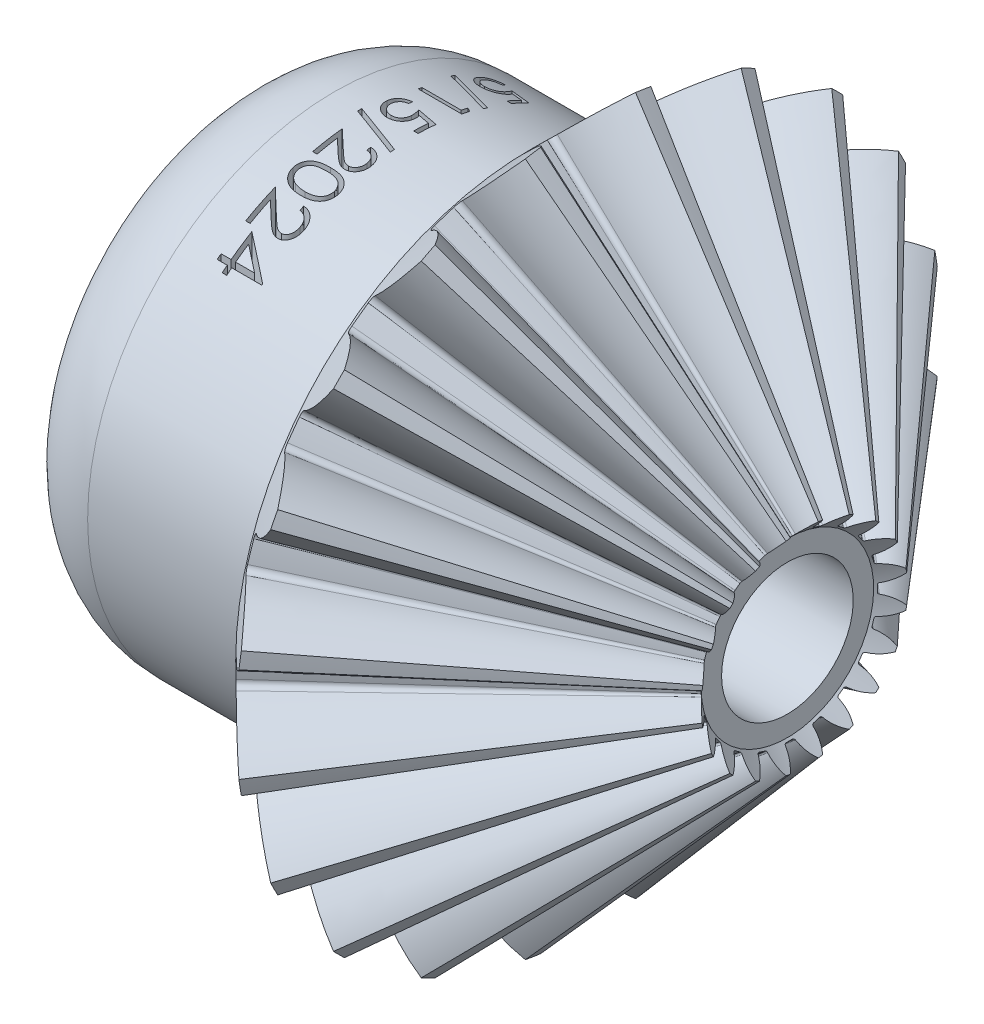
from build123d import *

# Parameters (mm, degrees)
TEETHCUTS_COUNT     = 20
TEETHCUTS_ANGLE     = 342
HUBSKE_R            = 7.5
HUB_DEPTH           = 8.949164146
BORSKE_R            = 2
BORE_DEPTH          = 20.0000508
FILLET2_R           = 3
SKETCH2_R           = 1.4
CUT_EXTRUDE1_DEPTH  = 10
SKETCH4_R           = 1.4
CUT_EXTRUDE2_DEPTH  = 10
BOSS_EXTRUDE1_START = -10
BOSS_EXTRUDE1_DEPTH = 10
CHAMFER1_SIZE       = 1
CUT_EXTRUDE3_START  = 5
CUT_EXTRUDE3_DEPTH  = 5


with BuildPart() as part:
    # BasProSke → Base-Revolve (revolve)
    with BuildSketch(Plane(origin=(0, 0, 0), x_dir=(1, 0, 0), z_dir=(0, 1, 0)), mode=Mode.PRIVATE) as base_revolve_sk:
        Polygon((0, 0), (0, 8.949062546), (1.758044235, 10.707106781), (8.329112047, 3.136038969), (7.814192812, 2.621119735), (7.814192812, 0), align=None)
    revolve(base_revolve_sk.sketch.rotate(Axis((-10, 0, 0), (1, 0, 0)), 180), axis=Axis((-10, 0, 0), (1, 0, 0)))

    # ToothCut: read off the stored shape, not the designer's step
    # ToothCut: loft between two sections, ruled curve by curve
    toothcut_from = [
        Edge.make_bspline([(11.056978067, 0.006040613, -0.009397446), (11.052757652, 0.001820198, -0.014823153), (11.047082229, -0.003855225, -0.014022361), (11.043703021, -0.007234432, -0.007524359)], [0, 0, 0, 0, 1, 1, 1, 1], 3, [1, 0.779680287, 0.779680287, 1]),
        Edge.make_bspline([(11.043703021, -0.007234432, 0.007524359), (11.047082229, -0.003855225, 0.014022361), (11.052757652, 0.001820198, 0.014823153), (11.056978067, 0.006040613, 0.009397446)], [0, 0, 0, 0, 1, 1, 1, 1], 3, [1, 0.779680287, 0.779680287, 1]),
        Edge.make_bspline([(11.043703021, -0.007234432, -0.007524359), (11.043200964, -0.00773649, -0.006558934), (11.04279988, -0.008137574, -0.005503268), (11.042507739, -0.008429715, -0.004378334)], [0, 0, 0, 0, 1, 1, 1, 1], 3, [1, 0.993377071, 0.993377071, 1]),
        Edge.make_bspline([(11.042507739, -0.008429715, 0.004378334), (11.04279988, -0.008137574, 0.005503268), (11.043200964, -0.00773649, 0.006558934), (11.043703021, -0.007234432, 0.007524359)], [0, 0, 0, 0, 1, 1, 1, 1], 3, [1, 0.993377071, 0.993377071, 1]),
        Edge.make_bspline([(11.042507739, -0.008429715, -0.004378334), (11.041765864, -0.00917159, -0.001521635), (11.041765864, -0.00917159, 0.001521635), (11.042507739, -0.008429715, 0.004378334)], [0, 0, 0, 0, 1, 1, 1, 1], 3, [1, 0.959129516, 0.959129516, 1]),
        Edge.make_line((11.056978067, 0.006040613, 0.009397446), (11.056978067, 0.006040613, -0.009397446)),
    ]
    toothcut_to = [
        Edge.make_bspline([(1.831702173, 10.78076472, -1.608058394), (1.416177175, 10.365239721, -1.022568098), (0.89518614, 9.844248687, -0.641441323), (0.317192873, 9.26625542, -0.500131372)], [0, 0, 0, 0, 1, 1, 1, 1], 3, [1, 0.968992554, 0.968992554, 1]),
        Edge.make_bspline([(0.317192873, 9.26625542, 0.500131372), (0.89518614, 9.844248687, 0.641441323), (1.416177175, 10.365239721, 1.022568098), (1.831702173, 10.78076472, 1.608058394)], [0, 0, 0, 0, 1, 1, 1, 1], 3, [1, 0.968992554, 0.968992554, 1]),
        Edge.make_bspline([(0.317192873, 9.26625542, -0.500131372), (0.248143517, 9.197206063, -0.483249928), (0.203953059, 9.153015606, -0.406340777), (0.206397022, 9.155459568, -0.307302074)], [0, 0, 0, 0, 1, 1, 1, 1], 3, [1, 0.835744927, 0.835744927, 1]),
        Edge.make_bspline([(0.206397022, 9.155459568, 0.307302074), (0.203953059, 9.153015606, 0.406340777), (0.248143517, 9.197206063, 0.483249928), (0.317192873, 9.26625542, 0.500131372)], [0, 0, 0, 0, 1, 1, 1, 1], 3, [1, 0.835744927, 0.835744927, 1]),
        Edge.make_bspline([(0.206397022, 9.155459568, -0.307302074), (0.211451493, 9.160514039, -0.102475588), (0.211451493, 9.160514039, 0.102475588), (0.206397022, 9.155459568, 0.307302074)], [0, 0, 0, 0, 1, 1, 1, 1], 3, [1, 0.999594406, 0.999594406, 1]),
        Edge.make_line((1.831702173, 10.78076472, 1.608058394), (1.831702173, 10.78076472, -1.608058394)),
    ]
    toothcut = Solid(Shell([*[Face.make_surface_from_curves(toothcut_from[k], toothcut_to[k]) for k in range(6)], Face(Wire(toothcut_from)), Face(Wire(toothcut_to))]))
    add(toothcut, mode=Mode.SUBTRACT)

    # TeethCuts: ToothCut ×20 about axis
    teethcuts_axis = Axis((-10, 0, 0), (1, 0, 0))
    for i in range(1, TEETHCUTS_COUNT):
        add(toothcut.rotate(teethcuts_axis, i * TEETHCUTS_ANGLE / (TEETHCUTS_COUNT - 1)), mode=Mode.SUBTRACT)

    # HubSke → Hub (add)
    with BuildSketch(Plane.ZY):
        with Locations(Location((0, 0, 0), (0, 0, 180))):
            Circle(HUBSKE_R)
    extrude(amount=HUB_DEPTH)

    # BorSke → Bore (cut, symmetric)
    with BuildSketch(Plane(origin=(0, 0, 0), x_dir=(0, 0, -1), z_dir=(1, 0, 0))):
        with Locations(Location((0, 0, 0), (0, 0, 180))):
            Circle(BORSKE_R)
    extrude(amount=BORE_DEPTH, both=True, mode=Mode.SUBTRACT)

    # Fillet2
    fillet2_edges = [part.edges().sort_by_distance(p)[0] for p in [
        (-8.949164146, 0, 7.5),
    ]]
    fillet(fillet2_edges, radius=FILLET2_R)

    # Sketch2 → Cut-Extrude1 (cut)
    with BuildSketch(Plane.XY):
        with Locations((-3.949164146, 0)):
            Circle(SKETCH2_R)
    extrude(amount=-CUT_EXTRUDE1_DEPTH, mode=Mode.SUBTRACT)

    # Sketch4 → Cut-Extrude2 (cut)
    with BuildSketch(Plane(origin=(0, 0, 0), x_dir=(1, 0, 0), z_dir=(0, 1, 0))):
        with Locations(Location((-3.949164146, 0, 0), (0, 0, 270))):
            Circle(SKETCH4_R)
    extrude(amount=-CUT_EXTRUDE2_DEPTH, mode=Mode.SUBTRACT)

    # Boss-Extrude1: read off the stored shape, not the designer's step
    # Boss-Extrude1 outline → Boss-Extrude1 (add)
    with BuildSketch(Plane.ZY.offset(8.949164146).offset(BOSS_EXTRUDE1_START)):
        with BuildLine():
            Line((-1.5, -1.322875656), (-1.499999766, 1.322875921))
            ThreePointArc((-1.499999766, 1.322875921), (-2, 1.77e-07), (-1.5, -1.322875656))
        make_face()
    extrude(amount=BOSS_EXTRUDE1_DEPTH)

    # Chamfer1
    chamfer1_edges = [part.edges().sort_by_distance(p)[0] for p in [
        (0, 0, 7.5),
    ]]
    chamfer(chamfer1_edges, length=CHAMFER1_SIZE)

    # Sketch7 → Cut-Extrude3 (cut)
    # profile 1 of 9: a face of its own
    with BuildSketch(Plane(origin=(0, 0, 0), x_dir=(1, 0, 0), z_dir=(0, 1, 0)).offset(CUT_EXTRUDE3_START)):
        with BuildLine():
            Line((-3.577080754, 3.003521014), (-3.712764515, 3.003521014))
            Line((-3.712764515, 3.003521014), (-3.712764515, 3.453503486))
            Line((-3.712764515, 3.453503486), (-4.060719159, 3.524790462))
            add(Edge.make_bspline(
                [(-4.060719159, 3.524790462), (-4.05685236, 3.510784224), (-4.049361048, 3.483649353), (-4.041043391, 3.443599048), (-4.036029369, 3.40557759), (-4.035344736, 3.380905054), (-4.035013446, 3.368966143)],
                knots=[0, 0, 0, 0, 1.100273476, 2.13160584, 3.095893838, 4, 4, 4, 4], degree=3))
            add(Edge.make_bspline(
                [(-4.035013446, 3.368966143), (-4.035333274, 3.354193471), (-4.035962134, 3.325146707), (-4.041997923, 3.282646738), (-4.051504531, 3.24208009), (-4.064763577, 3.203516075), (-4.081827793, 3.166871628), (-4.102867614, 3.13235139), (-4.127737509, 3.099759721), (-4.156197527, 3.069527472), (-4.187558575, 3.042143315), (-4.221167823, 3.017971234), (-4.25705584, 2.997867864), (-4.295063932, 2.98132852), (-4.335128327, 2.968206147), (-4.37754558, 2.959448217), (-4.421939277, 2.953623012), (-4.452292339, 2.952971721), (-4.467770441, 2.952639604)],
                knots=[0, 0, 0, 0, 1.052772836, 2.070014431, 3.053871312, 4.019926262, 4.972333346, 5.930471369, 6.896690565, 7.89035727, 8.885779078, 9.861050232, 10.836829716, 11.812751485, 12.812646763, 13.836748493, 14.896881366, 16, 16, 16, 16], degree=3))
            add(Edge.make_bspline(
                [(-4.467770441, 2.952639604), (-4.478551175, 2.952890953), (-4.499966952, 2.953390254), (-4.531771249, 2.955930216), (-4.56290321, 2.960817762), (-4.593362369, 2.967389163), (-4.623108004, 2.975884554), (-4.652129296, 2.986280526), (-4.680515607, 2.998534814), (-4.708268795, 3.012370195), (-4.734533274, 3.028375167), (-4.759714475, 3.045234538), (-4.782885678, 3.063910079), (-4.804892786, 3.083497616), (-4.824871545, 3.104780371), (-4.843676932, 3.127097763), (-4.860492081, 3.150973526), (-4.875958221, 3.175980194), (-4.889806003, 3.202101998), (-4.901357526, 3.229603808), (-4.911482536, 3.257881888), (-4.919716248, 3.287188277), (-4.926104418, 3.317466199), (-4.930454675, 3.34881992), (-4.933619866, 3.381092111), (-4.933818184, 3.402967442), (-4.933918361, 3.414017392)],
                knots=[0, 0, 0, 0, 1.05623316, 2.098192244, 3.122504159, 4.140841222, 5.148757784, 6.150489607, 7.158294732, 8.176043417, 9.185147859, 10.169157858, 11.142149047, 12.097904048, 13.0527185, 13.998867679, 14.954465986, 15.910220987, 16.877849176, 17.847023716, 18.829548819, 19.818454515, 20.826519638, 21.858115382, 22.918063636, 24, 24, 24, 24], degree=3))
            add(Edge.make_bspline(
                [(-4.933918361, 3.414017392), (-4.933657218, 3.427198986), (-4.933143449, 3.453132214), (-4.927769527, 3.491126825), (-4.92007126, 3.527681804), (-4.908495818, 3.562507849), (-4.893970324, 3.595898789), (-4.875728842, 3.627410126), (-4.854768549, 3.657661231), (-4.830366244, 3.685829914), (-4.80344415, 3.711920804), (-4.774541653, 3.735635155), (-4.743543831, 3.7564325), (-4.71071458, 3.77439771), (-4.675997413, 3.78969964), (-4.639288442, 3.801726425), (-4.600772334, 3.811431827), (-4.574256024, 3.815537997), (-4.560788019, 3.817623578)],
                knots=[0, 0, 0, 0, 1.046825758, 2.059506013, 3.044032586, 4.011925612, 4.970610144, 5.93275819, 6.900651216, 7.891265644, 8.889116719, 9.876966323, 10.858259055, 11.851035124, 12.847502422, 13.86866322, 14.9174643, 16, 16, 16, 16], degree=3))
            Line((-4.560788019, 3.817623578), (-4.560788019, 3.698900288))
            add(Edge.make_bspline(
                [(-4.560788019, 3.698900288), (-4.573404727, 3.695980916), (-4.59765474, 3.69036972), (-4.631706224, 3.678021058), (-4.66216494, 3.663015619), (-4.689059643, 3.644766608), (-4.712635716, 3.623437942), (-4.733826756, 3.599274397), (-4.75269126, 3.57193173), (-4.768516963, 3.541559663), (-4.781994049, 3.509498316), (-4.790972916, 3.475947495), (-4.797285118, 3.441814323), (-4.797917049, 3.41872819), (-4.7982346, 3.407127201)],
                knots=[0, 0, 0, 0, 1.136389429, 2.184203582, 3.172920998, 4.111012962, 5.028380909, 5.957351669, 6.927793475, 7.937618031, 8.960409703, 9.974842029, 10.982339866, 12, 12, 12, 12], degree=3))
            add(Edge.make_bspline(
                [(-4.7982346, 3.407127201), (-4.797924366, 3.395803622), (-4.797313512, 3.373507403), (-4.792611861, 3.340694766), (-4.785370755, 3.309015495), (-4.774534233, 3.278782179), (-4.761363759, 3.249465763), (-4.744462525, 3.22180782), (-4.725011863, 3.195008221), (-4.702727661, 3.169899968), (-4.678170663, 3.146904105), (-4.651909862, 3.126585571), (-4.623895459, 3.109660964), (-4.594612452, 3.095398369), (-4.563739902, 3.084568104), (-4.531422494, 3.0768419), (-4.497580403, 3.07230503), (-4.474497658, 3.071680923), (-4.462735301, 3.071362895)],
                knots=[0, 0, 0, 0, 1.027316725, 2.022795036, 3.002884548, 3.971462791, 4.93288096, 5.914575861, 6.907176829, 7.935150275, 8.956128384, 9.956726525, 10.942570165, 11.921478529, 12.907843606, 13.90538589, 14.932640048, 16, 16, 16, 16], degree=3))
            add(Edge.make_bspline(
                [(-4.462735301, 3.071362895), (-4.452116942, 3.071571696), (-4.431321102, 3.07198063), (-4.401030405, 3.076524886), (-4.372161606, 3.082890683), (-4.344972871, 3.092664552), (-4.319066059, 3.104740998), (-4.294995671, 3.120062295), (-4.272143297, 3.137576115), (-4.251437304, 3.158089643), (-4.232197651, 3.180458774), (-4.215820416, 3.20520277), (-4.202036359, 3.23175724), (-4.190142637, 3.259814843), (-4.181599973, 3.290039509), (-4.17518655, 3.321833639), (-4.171476567, 3.355540298), (-4.170961807, 3.378585769), (-4.170697207, 3.390431738)],
                knots=[0, 0, 0, 0, 1.045726679, 2.048034203, 3.01323695, 3.95502507, 4.889743367, 5.8246644, 6.761650845, 7.722168973, 8.692072792, 9.66525385, 10.638902184, 11.638179751, 12.663148338, 13.728659964, 14.832472288, 16, 16, 16, 16], degree=3))
            add(Edge.make_bspline(
                [(-4.170697207, 3.390431738), (-4.170909205, 3.400774876), (-4.171343197, 3.421948886), (-4.174758625, 3.454503889), (-4.180012933, 3.48856544), (-4.187586067, 3.524265777), (-4.197068152, 3.561506926), (-4.208910087, 3.60035082), (-4.222550504, 3.640798398), (-4.233130475, 3.668022513), (-4.238539087, 3.681939818)],
                knots=[0, 0, 0, 0, 0.824638674, 1.688163388, 2.607705698, 3.571998603, 4.597075385, 5.671199175, 6.809488238, 8, 8, 8, 8], degree=3))
            Line((-4.238539087, 3.681939818), (-3.577080754, 3.546256057))
            Line((-3.577080754, 3.546256057), (-3.577080754, 3.003521014))
        make_face()
    # profile 2 of 9: a face of its own
    with BuildSketch(Plane(origin=(0, 0, 0), x_dir=(1, 0, 0), z_dir=(0, 1, 0)).offset(CUT_EXTRUDE3_START)):
        Polygon((-3.543159814, 2.12157657), (-5.086562592, 2.674911906), (-5.086562592, 2.799995373), (-3.543159814, 2.246660037), align=None)
    # profile 3 of 9: a face of its own
    with BuildSketch(Plane(origin=(0, 0, 0), x_dir=(1, 0, 0), z_dir=(0, 1, 0)).offset(CUT_EXTRUDE3_START)):
        Polygon((-3.577080754, 1.738640956), (-3.577080754, 1.494039177), (-4.899997421, 1.494039177), (-4.899997421, 1.612762467), (-3.712764515, 1.612762467), (-3.712764515, 1.816288108), align=None)
    # profile 4 of 9: a face of its own
    with BuildSketch(Plane(origin=(0, 0, 0), x_dir=(1, 0, 0), z_dir=(0, 1, 0)).offset(CUT_EXTRUDE3_START)):
        with BuildLine():
            Line((-3.577080754, 0.17112251), (-3.712764515, 0.17112251))
            Line((-3.712764515, 0.17112251), (-3.712764515, 0.621104982))
            Line((-3.712764515, 0.621104982), (-4.060719159, 0.692391958))
            add(Edge.make_bspline(
                [(-4.060719159, 0.692391958), (-4.05685236, 0.67838572), (-4.049361048, 0.651250848), (-4.041043391, 0.611200544), (-4.036029369, 0.573179086), (-4.035344736, 0.54850655), (-4.035013446, 0.536567639)],
                knots=[0, 0, 0, 0, 1.100273476, 2.13160584, 3.095893838, 4, 4, 4, 4], degree=3))
            add(Edge.make_bspline(
                [(-4.035013446, 0.536567639), (-4.035333274, 0.521794967), (-4.035962134, 0.492748203), (-4.041997923, 0.450248233), (-4.051504531, 0.409681586), (-4.064763577, 0.37111757), (-4.081827793, 0.334473124), (-4.102867614, 0.299952886), (-4.127737509, 0.267361217), (-4.156197527, 0.237128967), (-4.187558575, 0.209744811), (-4.221167823, 0.18557273), (-4.25705584, 0.16546936), (-4.295063932, 0.148930016), (-4.335128327, 0.135807643), (-4.37754558, 0.127049713), (-4.421939277, 0.121224507), (-4.452292339, 0.120573216), (-4.467770441, 0.1202411)],
                knots=[0, 0, 0, 0, 1.052772836, 2.070014431, 3.053871312, 4.019926262, 4.972333346, 5.930471369, 6.896690565, 7.89035727, 8.885779078, 9.861050232, 10.836829716, 11.812751485, 12.812646763, 13.836748493, 14.896881366, 16, 16, 16, 16], degree=3))
            add(Edge.make_bspline(
                [(-4.467770441, 0.1202411), (-4.478551175, 0.120492449), (-4.499966952, 0.120991749), (-4.531771249, 0.123531712), (-4.56290321, 0.128419258), (-4.593362369, 0.134990659), (-4.623108004, 0.14348605), (-4.652129296, 0.153882022), (-4.680515607, 0.16613631), (-4.708268795, 0.179971691), (-4.734533274, 0.195976663), (-4.759714475, 0.212836033), (-4.782885678, 0.231511575), (-4.804892786, 0.251099111), (-4.824871545, 0.272381867), (-4.843676932, 0.294699259), (-4.860492081, 0.318575022), (-4.875958221, 0.343581689), (-4.889806003, 0.369703494), (-4.901357526, 0.397205304), (-4.911482536, 0.425483384), (-4.919716248, 0.454789773), (-4.926104418, 0.485067695), (-4.930454675, 0.516421416), (-4.933619866, 0.548693607), (-4.933818184, 0.570568938), (-4.933918361, 0.581618888)],
                knots=[0, 0, 0, 0, 1.05623316, 2.098192244, 3.122504159, 4.140841222, 5.148757784, 6.150489607, 7.158294732, 8.176043417, 9.185147859, 10.169157858, 11.142149047, 12.097904048, 13.0527185, 13.998867679, 14.954465986, 15.910220987, 16.877849176, 17.847023716, 18.829548819, 19.818454515, 20.826519638, 21.858115382, 22.918063636, 24, 24, 24, 24], degree=3))
            add(Edge.make_bspline(
                [(-4.933918361, 0.581618888), (-4.933657218, 0.594800481), (-4.933143449, 0.62073371), (-4.927769527, 0.658728321), (-4.92007126, 0.695283299), (-4.908495818, 0.730109344), (-4.893970324, 0.763500284), (-4.875728842, 0.795011622), (-4.854768549, 0.825262727), (-4.830366244, 0.85343141), (-4.80344415, 0.879522299), (-4.774541653, 0.903236651), (-4.743543831, 0.924033996), (-4.71071458, 0.941999205), (-4.675997413, 0.957301135), (-4.639288442, 0.969327921), (-4.600772334, 0.979033323), (-4.574256024, 0.983139493), (-4.560788019, 0.985225074)],
                knots=[0, 0, 0, 0, 1.046825758, 2.059506013, 3.044032586, 4.011925612, 4.970610144, 5.93275819, 6.900651216, 7.891265644, 8.889116719, 9.876966323, 10.858259055, 11.851035124, 12.847502422, 13.86866322, 14.9174643, 16, 16, 16, 16], degree=3))
            Line((-4.560788019, 0.985225074), (-4.560788019, 0.866501784))
            add(Edge.make_bspline(
                [(-4.560788019, 0.866501784), (-4.573404727, 0.863582411), (-4.59765474, 0.857971216), (-4.631706224, 0.845622553), (-4.66216494, 0.830617115), (-4.689059643, 0.812368104), (-4.712635716, 0.791039438), (-4.733826756, 0.766875892), (-4.75269126, 0.739533225), (-4.768516963, 0.709161159), (-4.781994049, 0.677099812), (-4.790972916, 0.643548991), (-4.797285118, 0.609415818), (-4.797917049, 0.586329686), (-4.7982346, 0.574728697)],
                knots=[0, 0, 0, 0, 1.136389429, 2.184203582, 3.172920998, 4.111012962, 5.028380909, 5.957351669, 6.927793475, 7.937618031, 8.960409703, 9.974842029, 10.982339866, 12, 12, 12, 12], degree=3))
            add(Edge.make_bspline(
                [(-4.7982346, 0.574728697), (-4.797924366, 0.563405118), (-4.797313512, 0.541108899), (-4.792611861, 0.508296262), (-4.785370755, 0.476616991), (-4.774534233, 0.446383674), (-4.761363759, 0.417067259), (-4.744462525, 0.389409316), (-4.725011863, 0.362609717), (-4.702727661, 0.337501464), (-4.678170663, 0.314505601), (-4.651909862, 0.294187067), (-4.623895459, 0.27726246), (-4.594612452, 0.262999865), (-4.563739902, 0.2521696), (-4.531422494, 0.244443396), (-4.497580403, 0.239906525), (-4.474497658, 0.239282419), (-4.462735301, 0.23896439)],
                knots=[0, 0, 0, 0, 1.027316725, 2.022795036, 3.002884548, 3.971462791, 4.93288096, 5.914575861, 6.907176829, 7.935150275, 8.956128384, 9.956726525, 10.942570165, 11.921478529, 12.907843606, 13.90538589, 14.932640048, 16, 16, 16, 16], degree=3))
            add(Edge.make_bspline(
                [(-4.462735301, 0.23896439), (-4.452116942, 0.239173192), (-4.431321102, 0.239582126), (-4.401030405, 0.244126381), (-4.372161606, 0.250492179), (-4.344972871, 0.260266048), (-4.319066059, 0.272342493), (-4.294995671, 0.28766379), (-4.272143297, 0.305177611), (-4.251437304, 0.325691139), (-4.232197651, 0.34806027), (-4.215820416, 0.372804265), (-4.202036359, 0.399358735), (-4.190142637, 0.427416339), (-4.181599973, 0.457641004), (-4.17518655, 0.489435134), (-4.171476567, 0.523141794), (-4.170961807, 0.546187264), (-4.170697207, 0.558033234)],
                knots=[0, 0, 0, 0, 1.045726679, 2.048034203, 3.01323695, 3.95502507, 4.889743367, 5.8246644, 6.761650845, 7.722168973, 8.692072792, 9.66525385, 10.638902184, 11.638179751, 12.663148338, 13.728659964, 14.832472288, 16, 16, 16, 16], degree=3))
            add(Edge.make_bspline(
                [(-4.170697207, 0.558033234), (-4.170909205, 0.568376372), (-4.171343197, 0.589550381), (-4.174758625, 0.622105385), (-4.180012933, 0.656166936), (-4.187586067, 0.691867273), (-4.197068152, 0.729108422), (-4.208910087, 0.767952316), (-4.222550504, 0.808399893), (-4.233130475, 0.835624009), (-4.238539087, 0.849541313)],
                knots=[0, 0, 0, 0, 0.824638674, 1.688163388, 2.607705698, 3.571998603, 4.597075385, 5.671199175, 6.809488238, 8, 8, 8, 8], degree=3))
            Line((-4.238539087, 0.849541313), (-3.577080754, 0.713857553))
            Line((-3.577080754, 0.713857553), (-3.577080754, 0.17112251))
        make_face()
    # profile 5 of 9: a face of its own
    with BuildSketch(Plane(origin=(0, 0, 0), x_dir=(1, 0, 0), z_dir=(0, 1, 0)).offset(CUT_EXTRUDE3_START)):
        Polygon((-3.543159814, -0.710821934), (-5.086562592, -0.157486598), (-5.086562592, -0.032403131), (-3.543159814, -0.585738467), align=None)
    # profile 6 of 9: a face of its own
    with BuildSketch(Plane(origin=(0, 0, 0), x_dir=(1, 0, 0), z_dir=(0, 1, 0)).offset(CUT_EXTRUDE3_START)):
        with BuildLine():
            Line((-3.984132036, -0.982189456), (-3.984132036, -0.863466165))
            add(Edge.make_bspline(
                [(-3.984132036, -0.863466165), (-3.968381355, -0.864239809), (-3.937447437, -0.865759224), (-3.89234694, -0.872877732), (-3.849232965, -0.883053997), (-3.808475137, -0.897476139), (-3.769586567, -0.915286224), (-3.733083652, -0.937090922), (-3.698604104, -0.962425392), (-3.666800735, -0.991243158), (-3.63772848, -1.022513089), (-3.612357428, -1.056047831), (-3.591166627, -1.091502709), (-3.57335527, -1.128570204), (-3.560001917, -1.167679011), (-3.550089596, -1.208455295), (-3.544126831, -1.25108336), (-3.543485821, -1.280127027), (-3.543159814, -1.294898123)],
                knots=[0, 0, 0, 0, 1.100776268, 2.161895295, 3.184016182, 4.190939212, 5.176500551, 6.166955529, 7.155448256, 8.160289653, 9.16017456, 10.133824356, 11.091467644, 12.04088621, 13.000931625, 13.972173743, 14.968683325, 16, 16, 16, 16], degree=3))
            add(Edge.make_bspline(
                [(-3.543159814, -1.294898123), (-3.543499409, -1.309404121), (-3.544166701, -1.33790789), (-3.54989721, -1.37950871), (-3.558872478, -1.419112033), (-3.571464912, -1.456640445), (-3.588392359, -1.491794523), (-3.608726548, -1.524838352), (-3.632244163, -1.556165325), (-3.65993236, -1.584364913), (-3.689490999, -1.610259336), (-3.721047439, -1.632598581), (-3.753640056, -1.651729152), (-3.787517382, -1.66767509), (-3.822998396, -1.679413572), (-3.859566535, -1.688325573), (-3.897600318, -1.693363018), (-3.923342974, -1.694136139), (-3.936430714, -1.694529199)],
                knots=[0, 0, 0, 0, 1.111607364, 2.184268762, 3.212621178, 4.221274766, 5.211760367, 6.196651075, 7.1921475, 8.207485113, 9.220403448, 10.201281604, 11.166441695, 12.114753415, 13.065576456, 14.026450734, 14.996634279, 16, 16, 16, 16], degree=3))
            add(Edge.make_bspline(
                [(-3.936430714, -1.694529199), (-3.954856235, -1.693889186), (-3.991383935, -1.692620392), (-4.045062172, -1.681767041), (-4.097069208, -1.664816127), (-4.138925271, -1.644406412), (-4.172653408, -1.623817125), (-4.200422829, -1.605263216), (-4.230322812, -1.583542886), (-4.262253234, -1.558340001), (-4.296464202, -1.53017591), (-4.332935047, -1.498795509), (-4.37128896, -1.463975026), (-4.397484827, -1.439535652), (-4.411058869, -1.426871781)],
                knots=[0, 0, 0, 0, 1.184426356, 2.348067706, 3.509069118, 4.696110526, 5.333549288, 6.050745305, 6.844228056, 7.710549037, 8.667450064, 9.695053472, 10.805634456, 12, 12, 12, 12], degree=3))
            Line((-4.411058869, -1.426871781), (-4.76431366, -1.095877607))
            Line((-4.76431366, -1.095877607), (-4.76431366, -1.711489669))
            Line((-4.76431366, -1.711489669), (-4.899997421, -1.711489669))
            Line((-4.899997421, -1.711489669), (-4.899997421, -0.812584755))
            Line((-4.899997421, -0.812584755), (-4.352492246, -1.325638975))
            add(Edge.make_bspline(
                [(-4.352492246, -1.325638975), (-4.339453419, -1.338131174), (-4.3144085, -1.362126131), (-4.277832607, -1.396050172), (-4.243940489, -1.426568427), (-4.212581962, -1.453701139), (-4.183934798, -1.477470635), (-4.157774497, -1.497800861), (-4.134325559, -1.514781674), (-4.106778727, -1.532777797), (-4.073105762, -1.549938295), (-4.032162627, -1.565020616), (-3.989921674, -1.574151248), (-3.961385133, -1.575252147), (-3.947031008, -1.575805909)],
                knots=[0, 0, 0, 0, 1.329530082, 2.553755191, 3.672934919, 4.687409497, 5.60679272, 6.413407421, 7.126401618, 7.737995624, 8.834647426, 9.90044882, 10.943907757, 12, 12, 12, 12], degree=3))
            add(Edge.make_bspline(
                [(-3.947031008, -1.575805909), (-3.93800341, -1.575568082), (-3.920211749, -1.57509937), (-3.894143527, -1.570884408), (-3.868900187, -1.564691792), (-3.844793844, -1.555147058), (-3.821350373, -1.543679411), (-3.799282528, -1.529028647), (-3.77783807, -1.51228667), (-3.757752312, -1.492866799), (-3.739350639, -1.471547388), (-3.72305111, -1.449021449), (-3.709429093, -1.425190202), (-3.698262379, -1.400152962), (-3.68950263, -1.373979837), (-3.683432871, -1.346620123), (-3.679621932, -1.318149439), (-3.679106308, -1.298708802), (-3.678843575, -1.288802954)],
                knots=[0, 0, 0, 0, 0.991504627, 1.954065223, 2.895985987, 3.842598665, 4.797835564, 5.759220273, 6.74786863, 7.784730864, 8.824135544, 9.839918996, 10.835834653, 11.835434876, 12.84861661, 13.863796685, 14.911511676, 16, 16, 16, 16], degree=3))
            add(Edge.make_bspline(
                [(-3.678843575, -1.288802954), (-3.679113758, -1.278457385), (-3.679644354, -1.258140396), (-3.683358247, -1.228311532), (-3.68975915, -1.199852929), (-3.698534652, -1.172706979), (-3.70958308, -1.146847528), (-3.72360989, -1.122508395), (-3.740067425, -1.099467374), (-3.758828117, -1.077766782), (-3.779814174, -1.057827342), (-3.802920149, -1.039940045), (-3.828296342, -1.024684071), (-3.855369583, -1.011160337), (-3.884859714, -1.000812679), (-3.916052123, -0.9919676), (-3.949389979, -0.985542305), (-3.972359007, -0.983325635), (-3.984132036, -0.982189456)],
                knots=[0, 0, 0, 0, 1.031212865, 2.025131798, 2.990757446, 3.934781266, 4.865570067, 5.788494791, 6.729227313, 7.684356718, 8.643577152, 9.610526866, 10.590658432, 11.59095419, 12.621640561, 13.700587263, 14.82141059, 16, 16, 16, 16], degree=3))
        make_face()
    # profile 7 of 9: a face of its own
    with BuildSketch(Plane(origin=(0, 0, 0), x_dir=(1, 0, 0), z_dir=(0, 1, 0)).offset(CUT_EXTRUDE3_START)):
        with BuildLine():
            add(Edge.make_bspline(
                [(-4.239069102, -1.83021296), (-4.217865625, -1.830336943), (-4.176677566, -1.830577782), (-4.116660752, -1.833257036), (-4.060357309, -1.837707835), (-4.007764544, -1.843807379), (-3.958868874, -1.851230064), (-3.913800984, -1.861138905), (-3.872352231, -1.872407398), (-3.83438764, -1.885467523), (-3.799395086, -1.900203556), (-3.766729782, -1.916244188), (-3.736433201, -1.934217256), (-3.708050205, -1.953126257), (-3.681897564, -1.973662174), (-3.658024804, -1.995608405), (-3.63641751, -2.019182648), (-3.616818519, -2.043918657), (-3.599745299, -2.069972758), (-3.584361193, -2.096541789), (-3.571734517, -2.124094583), (-3.561359441, -2.152379848), (-3.553046155, -2.18131533), (-3.547289221, -2.211020586), (-3.543681171, -2.241502793), (-3.543335248, -2.262076349), (-3.543159814, -2.272510219)],
                knots=[0, 0, 0, 0, 1.646377244, 3.198111528, 4.663803227, 6.031090796, 7.308794487, 8.502186765, 9.612154809, 10.642545331, 11.617106989, 12.558866172, 13.465886467, 14.35053239, 15.20542558, 16.045215227, 16.865619885, 17.686225247, 18.492864914, 19.282407821, 20.068097601, 20.842842034, 21.620163247, 22.403093475, 23.190129512, 24, 24, 24, 24], degree=3))
            add(Edge.make_bspline(
                [(-3.543159814, -2.272510219), (-3.543344197, -2.283031367), (-3.543710875, -2.30395462), (-3.547235104, -2.334888334), (-3.55308282, -2.36510741), (-3.561368426, -2.394483016), (-3.571647745, -2.423256448), (-3.584531863, -2.45120265), (-3.59952953, -2.478495208), (-3.617152246, -2.504700406), (-3.636800309, -2.53010593), (-3.659011198, -2.554087749), (-3.683560646, -2.576648046), (-3.710185993, -2.598069962), (-3.739397915, -2.617745739), (-3.770688337, -2.636483316), (-3.804604468, -2.653254889), (-3.840580419, -2.669407579), (-3.879611623, -2.683349981), (-3.921478065, -2.69592383), (-3.966674261, -2.70608344), (-4.01496308, -2.714546052), (-4.066521861, -2.72110201), (-4.121240081, -2.725876848), (-4.179153741, -2.728399115), (-4.218749713, -2.728874118), (-4.239069102, -2.729117875)],
                knots=[0, 0, 0, 0, 0.810914788, 1.612654377, 2.396697861, 3.181598691, 3.963628158, 4.749916497, 5.551656086, 6.361998678, 7.18212741, 8.025565596, 8.878627764, 9.750805457, 10.657531673, 11.591944965, 12.560506719, 13.57287815, 14.630710178, 15.753379473, 16.941251878, 18.199788006, 19.531962791, 20.947069417, 22.433333509, 24, 24, 24, 24], degree=3))
            add(Edge.make_bspline(
                [(-4.239069102, -2.729117875), (-4.259299789, -2.728871287), (-4.298718458, -2.72839082), (-4.35637258, -2.725908431), (-4.410796741, -2.720995602), (-4.462142435, -2.714919208), (-4.510104808, -2.706263469), (-4.555139924, -2.696423419), (-4.596859136, -2.684193292), (-4.635684493, -2.670440925), (-4.671484185, -2.654638733), (-4.705107126, -2.63771893), (-4.736372017, -2.619096368), (-4.765583514, -2.59930325), (-4.792439773, -2.578063418), (-4.817007166, -2.555407591), (-4.839269491, -2.531318525), (-4.859186007, -2.505855561), (-4.876603582, -2.479238118), (-4.892172093, -2.45203666), (-4.904804973, -2.423708269), (-4.915471159, -2.394882521), (-4.923775827, -2.365287427), (-4.929461977, -2.334952014), (-4.933460944, -2.303975631), (-4.933765361, -2.283035007), (-4.933918361, -2.272510219)],
                knots=[0, 0, 0, 0, 1.56130642, 3.042141888, 4.451772327, 5.777565838, 7.030558081, 8.211376819, 9.333164717, 10.383253789, 11.387583522, 12.350962576, 13.286244149, 14.193812918, 15.072134482, 15.925989337, 16.770211267, 17.600669898, 18.417446232, 19.22325363, 20.01647746, 20.807971184, 21.593601364, 22.38506573, 23.188331689, 24, 24, 24, 24], degree=3))
            add(Edge.make_bspline(
                [(-4.933918361, -2.272510219), (-4.933741238, -2.262076773), (-4.933391987, -2.241504053), (-4.929808321, -2.211015723), (-4.92396457, -2.181356795), (-4.916028785, -2.152467979), (-4.905942872, -2.124290153), (-4.893113965, -2.097099347), (-4.878234429, -2.070536464), (-4.861306172, -2.044722712), (-4.84190683, -2.020150084), (-4.820451735, -1.996677794), (-4.796402747, -1.974898508), (-4.770144809, -1.954619971), (-4.74190072, -1.935376741), (-4.711392252, -1.917579795), (-4.678420894, -1.901570451), (-4.64323517, -1.886504171), (-4.604991558, -1.873223274), (-4.563321734, -1.861580486), (-4.517995189, -1.851874594), (-4.469146484, -1.844069065), (-4.416739058, -1.837634191), (-4.360680637, -1.833278111), (-4.301019587, -1.830575648), (-4.260096094, -1.830336062), (-4.239069102, -1.83021296)],
                knots=[0, 0, 0, 0, 0.810940842, 1.599017053, 2.38298203, 3.159479784, 3.926441347, 4.70693857, 5.494146311, 6.292334103, 7.104379492, 7.925868426, 8.762126819, 9.623561095, 10.503686106, 11.41783325, 12.366995289, 13.351843594, 14.392337808, 15.512229747, 16.713911458, 17.994391108, 19.357476964, 20.818259213, 22.365182633, 24, 24, 24, 24], degree=3))
        make_face()
        with BuildLine():
            add(Edge.make_bspline(
                [(-4.238539087, -1.948936251), (-4.256208983, -1.948981399), (-4.290502779, -1.949069022), (-4.340336393, -1.951358122), (-4.386816249, -1.954476513), (-4.430001365, -1.958498671), (-4.469745569, -1.964471806), (-4.506322195, -1.971164562), (-4.539537733, -1.979309188), (-4.569619916, -1.988945825), (-4.597079924, -1.999921478), (-4.622630212, -2.011907057), (-4.646580555, -2.024775829), (-4.668687698, -2.039203088), (-4.689171701, -2.054861591), (-4.707973699, -2.071777051), (-4.725011653, -2.089919719), (-4.745228838, -2.115035119), (-4.766367727, -2.148028838), (-4.784548785, -2.18981291), (-4.796048363, -2.232766648), (-4.797506699, -2.26192933), (-4.7982346, -2.276485329)],
                knots=[0, 0, 0, 0, 1.459116078, 2.831857795, 4.118796693, 5.306371758, 6.412361096, 7.436813035, 8.376339383, 9.234574298, 10.043323891, 10.816788787, 11.564361537, 12.286735248, 12.994408768, 13.691741332, 14.372975427, 15.047457468, 16.352811911, 17.594285292, 18.799233213, 20, 20, 20, 20], degree=3))
            add(Edge.make_bspline(
                [(-4.7982346, -2.276485329), (-4.797630677, -2.291134806), (-4.796424078, -2.320403515), (-4.784782888, -2.363165396), (-4.767218509, -2.404678623), (-4.74644966, -2.437211767), (-4.726670798, -2.461962609), (-4.709807523, -2.479696114), (-4.690925394, -2.495972543), (-4.670552744, -2.511409875), (-4.648300346, -2.525568514), (-4.624275206, -2.538443569), (-4.598410606, -2.550192334), (-4.580354782, -2.556885932), (-4.571123306, -2.560308196)],
                knots=[0, 0, 0, 0, 1.353760809, 2.704726607, 4.075137775, 5.516104923, 6.260822281, 7.007110065, 7.778089737, 8.566572457, 9.372053459, 10.217411131, 11.088608312, 12, 12, 12, 12], degree=3))
            add(Edge.make_bspline(
                [(-4.571123306, -2.560308196), (-4.559319208, -2.564296513), (-4.535351826, -2.572394507), (-4.498172708, -2.5828311), (-4.45916452, -2.591050343), (-4.418560384, -2.59844483), (-4.376060854, -2.603491967), (-4.331797429, -2.607554384), (-4.285736736, -2.609947233), (-4.254442201, -2.61024385), (-4.238539087, -2.610394584)],
                knots=[0, 0, 0, 0, 0.884706709, 1.796334032, 2.740027952, 3.714592787, 4.726048262, 5.777819803, 6.87074269, 8, 8, 8, 8], degree=3))
            add(Edge.make_bspline(
                [(-4.238539087, -2.610394584), (-4.222636316, -2.610228341), (-4.191523248, -2.609903094), (-4.146004801, -2.607766191), (-4.102696538, -2.604332366), (-4.061559171, -2.599684759), (-4.022665919, -2.593304577), (-3.985961128, -2.585642614), (-3.951454692, -2.576659841), (-3.919057622, -2.566356333), (-3.888886362, -2.554744422), (-3.860875223, -2.541916742), (-3.834875706, -2.528227869), (-3.810962441, -2.513356915), (-3.789027488, -2.497483679), (-3.769510849, -2.480188381), (-3.751807589, -2.462157272), (-3.731600011, -2.436901964), (-3.710995888, -2.403838767), (-3.692034425, -2.362697703), (-3.681145576, -2.319884097), (-3.679610355, -2.290941154), (-3.678843575, -2.276485329)],
                knots=[0, 0, 0, 0, 1.313668642, 2.570134578, 3.763346207, 4.902004944, 5.98888779, 7.017888835, 7.998425394, 8.933058446, 9.82474457, 10.667209444, 11.476765193, 12.250262638, 12.991704352, 13.7104269, 14.401925311, 15.076585796, 16.378385137, 17.609787933, 18.806186071, 20, 20, 20, 20], degree=3))
            add(Edge.make_bspline(
                [(-3.678843575, -2.276485329), (-3.679610424, -2.261853033), (-3.681145519, -2.232561783), (-3.692005872, -2.189312488), (-3.710819352, -2.147878357), (-3.731733066, -2.115080423), (-3.751449857, -2.089856979), (-3.768595655, -2.072045706), (-3.787454531, -2.055394021), (-3.80785181, -2.039722472), (-3.829970103, -2.025309102), (-3.853916963, -2.012435063), (-3.879469626, -2.000456364), (-3.906923386, -1.989457147), (-3.93705092, -1.979909817), (-3.970098822, -1.971376264), (-4.006709612, -1.964687569), (-4.04656493, -1.95885073), (-4.089803134, -1.954400471), (-4.136390149, -1.951366127), (-4.18630994, -1.949064881), (-4.220780679, -1.948979986), (-4.238539087, -1.948936251)],
                knots=[0, 0, 0, 0, 1.207964612, 2.418129846, 3.655795183, 4.951004962, 5.620895151, 6.296795572, 6.989224116, 7.696855977, 8.419187164, 9.166715907, 9.940135271, 10.748837255, 11.607021648, 12.548275234, 13.5654991, 14.678641405, 15.874140913, 17.15372626, 18.533675393, 20, 20, 20, 20], degree=3))
        make_face(mode=Mode.SUBTRACT)
    # profile 8 of 9: a face of its own
    with BuildSketch(Plane(origin=(0, 0, 0), x_dir=(1, 0, 0), z_dir=(0, 1, 0)).offset(CUT_EXTRUDE3_START)):
        with BuildLine():
            Line((-3.984132036, -3.017445866), (-3.984132036, -2.898722575))
            add(Edge.make_bspline(
                [(-3.984132036, -2.898722575), (-3.968381355, -2.899496219), (-3.937447437, -2.901015634), (-3.89234694, -2.908134143), (-3.849232965, -2.918310408), (-3.808475137, -2.93273255), (-3.769586567, -2.950542634), (-3.733083652, -2.972347332), (-3.698604104, -2.997681803), (-3.666800735, -3.026499568), (-3.63772848, -3.057769499), (-3.612357428, -3.091304241), (-3.591166627, -3.126759119), (-3.57335527, -3.163826614), (-3.560001917, -3.202935422), (-3.550089596, -3.243711706), (-3.544126831, -3.286339771), (-3.543485821, -3.315383437), (-3.543159814, -3.330154533)],
                knots=[0, 0, 0, 0, 1.100776268, 2.161895295, 3.184016182, 4.190939212, 5.176500551, 6.166955529, 7.155448256, 8.160289653, 9.16017456, 10.133824356, 11.091467644, 12.04088621, 13.000931625, 13.972173743, 14.968683325, 16, 16, 16, 16], degree=3))
            add(Edge.make_bspline(
                [(-3.543159814, -3.330154533), (-3.543499409, -3.344660531), (-3.544166701, -3.3731643), (-3.54989721, -3.414765121), (-3.558872478, -3.454368443), (-3.571464912, -3.491896855), (-3.588392359, -3.527050933), (-3.608726548, -3.560094762), (-3.632244163, -3.591421736), (-3.65993236, -3.619621323), (-3.689490999, -3.645515746), (-3.721047439, -3.667854991), (-3.753640056, -3.686985562), (-3.787517382, -3.702931501), (-3.822998396, -3.714669982), (-3.859566535, -3.723581983), (-3.897600318, -3.728619428), (-3.923342974, -3.729392549), (-3.936430714, -3.72978561)],
                knots=[0, 0, 0, 0, 1.111607364, 2.184268762, 3.212621178, 4.221274766, 5.211760367, 6.196651075, 7.1921475, 8.207485113, 9.220403448, 10.201281604, 11.166441695, 12.114753415, 13.065576456, 14.026450734, 14.996634279, 16, 16, 16, 16], degree=3))
            add(Edge.make_bspline(
                [(-3.936430714, -3.72978561), (-3.954856235, -3.729145597), (-3.991383935, -3.727876802), (-4.045062172, -3.717023451), (-4.097069208, -3.700072538), (-4.138925271, -3.679662822), (-4.172653408, -3.659073536), (-4.200422829, -3.640519626), (-4.230322812, -3.618799296), (-4.262253234, -3.593596411), (-4.296464202, -3.56543232), (-4.332935047, -3.534051919), (-4.37128896, -3.499231436), (-4.397484827, -3.474792062), (-4.411058869, -3.462128191)],
                knots=[0, 0, 0, 0, 1.184426356, 2.348067706, 3.509069118, 4.696110526, 5.333549288, 6.050745305, 6.844228056, 7.710549037, 8.667450064, 9.695053472, 10.805634456, 12, 12, 12, 12], degree=3))
            Line((-4.411058869, -3.462128191), (-4.76431366, -3.131134017))
            Line((-4.76431366, -3.131134017), (-4.76431366, -3.74674608))
            Line((-4.76431366, -3.74674608), (-4.899997421, -3.74674608))
            Line((-4.899997421, -3.74674608), (-4.899997421, -2.847841165))
            Line((-4.899997421, -2.847841165), (-4.352492246, -3.360895385))
            add(Edge.make_bspline(
                [(-4.352492246, -3.360895385), (-4.339453419, -3.373387584), (-4.3144085, -3.397382541), (-4.277832607, -3.431306582), (-4.243940489, -3.461824837), (-4.212581962, -3.48895755), (-4.183934798, -3.512727045), (-4.157774497, -3.533057271), (-4.134325559, -3.550038084), (-4.106778727, -3.568034207), (-4.073105762, -3.585194705), (-4.032162627, -3.600277026), (-3.989921674, -3.609407659), (-3.961385133, -3.610508557), (-3.947031008, -3.611062319)],
                knots=[0, 0, 0, 0, 1.329530082, 2.553755191, 3.672934919, 4.687409497, 5.60679272, 6.413407421, 7.126401618, 7.737995624, 8.834647426, 9.90044882, 10.943907757, 12, 12, 12, 12], degree=3))
            add(Edge.make_bspline(
                [(-3.947031008, -3.611062319), (-3.93800341, -3.610824492), (-3.920211749, -3.61035578), (-3.894143527, -3.606140818), (-3.868900187, -3.599948202), (-3.844793844, -3.590403468), (-3.821350373, -3.578935821), (-3.799282528, -3.564285057), (-3.77783807, -3.54754308), (-3.757752312, -3.528123209), (-3.739350639, -3.506803799), (-3.72305111, -3.48427786), (-3.709429093, -3.460446612), (-3.698262379, -3.435409372), (-3.68950263, -3.409236247), (-3.683432871, -3.381876533), (-3.679621932, -3.35340585), (-3.679106308, -3.333965213), (-3.678843575, -3.324059364)],
                knots=[0, 0, 0, 0, 0.991504627, 1.954065223, 2.895985987, 3.842598665, 4.797835564, 5.759220273, 6.74786863, 7.784730864, 8.824135544, 9.839918996, 10.835834653, 11.835434876, 12.84861661, 13.863796685, 14.911511676, 16, 16, 16, 16], degree=3))
            add(Edge.make_bspline(
                [(-3.678843575, -3.324059364), (-3.679113758, -3.313713795), (-3.679644354, -3.293396806), (-3.683358247, -3.263567942), (-3.68975915, -3.235109339), (-3.698534652, -3.20796339), (-3.70958308, -3.182103938), (-3.72360989, -3.157764806), (-3.740067425, -3.134723784), (-3.758828117, -3.113023192), (-3.779814174, -3.093083753), (-3.802920149, -3.075196455), (-3.828296342, -3.059940481), (-3.855369583, -3.046416747), (-3.884859714, -3.036069089), (-3.916052123, -3.027224011), (-3.949389979, -3.020798715), (-3.972359007, -3.018582045), (-3.984132036, -3.017445866)],
                knots=[0, 0, 0, 0, 1.031212865, 2.025131798, 2.990757446, 3.934781266, 4.865570067, 5.788494791, 6.729227313, 7.684356718, 8.643577152, 9.610526866, 10.590658432, 11.59095419, 12.621640561, 13.700587263, 14.82141059, 16, 16, 16, 16], degree=3))
        make_face()
    # profile 9 of 9: a face of its own
    with BuildSketch(Plane(origin=(0, 0, 0), x_dir=(1, 0, 0), z_dir=(0, 1, 0)).offset(CUT_EXTRUDE3_START)):
        Polygon((-3.543159814, -4.587614386), (-3.543159814, -4.611730054), (-4.459025199, -4.611730054), (-4.459025199, -4.764374285), (-4.594708959, -4.764374285), (-4.594708959, -4.611730054), (-4.899997421, -4.611730054), (-4.899997421, -4.493006763), (-4.594708959, -4.493006763), (-4.594708959, -3.86546937), align=None)
        Polygon((-4.459025199, -4.493006763), (-3.884489274, -4.493006763), (-4.459025199, -4.098675834), align=None, mode=Mode.SUBTRACT)
    extrude(amount=CUT_EXTRUDE3_DEPTH, mode=Mode.SUBTRACT)


solid = part.part
